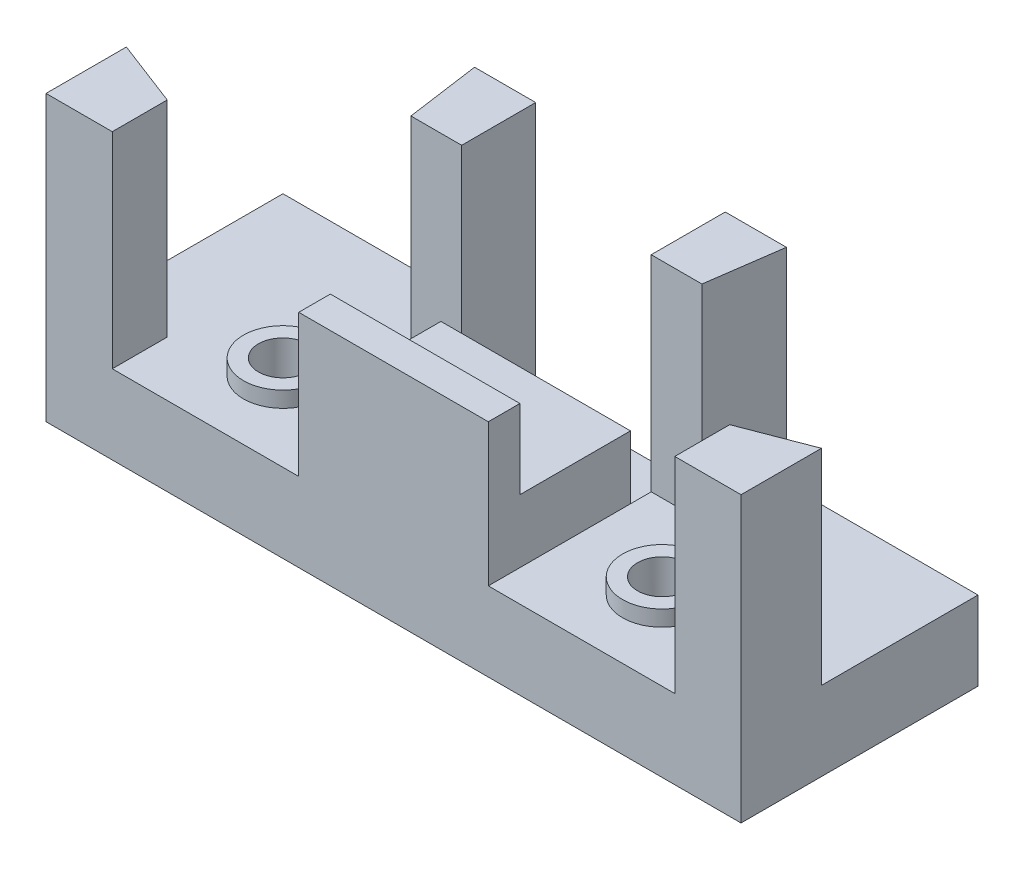
from build123d import *

# Parameters (mm, degrees)
SKETCH1_W           = 44
SKETCH1_H           = 15
BOSS_EXTRUDE1_DEPTH = 5
SKETCH2_W           = 12
SKETCH2_H           = 15
BOSS_EXTRUDE2_DEPTH = 4
SKETCH3_R           = 1.55
CUT_EXTRUDE1_DEPTH  = 3
SKETCH4_R           = 1.55
CUT_EXTRUDE2_DEPTH  = 3
BOSS_EXTRUDE3_START = 1
SKETCH5_R           = 2.5
SKETCH5_R_2         = 1.55
BOSS_EXTRUDE3_DEPTH = 1
SKETCH6_W           = 12
SKETCH6_H           = 2
BOSS_EXTRUDE4_DEPTH = 5
BOSS_EXTRUDE5_DEPTH = 13
SKETCH10_W          = 12
SKETCH10_H          = 6
CUT_EXTRUDE4_DEPTH  = 7


with BuildPart() as part:
    # Sketch1 → Boss-Extrude1 (new body)
    with BuildSketch(Plane(origin=(0, 0, 0), x_dir=(1, 0, 0), z_dir=(0, 1, 0))):
        with Locations((22, -7.5)):
            Rectangle(SKETCH1_W, SKETCH1_H)
    extrude(amount=BOSS_EXTRUDE1_DEPTH)

    # Sketch2 → Boss-Extrude2 (add)
    with BuildSketch(Plane(origin=(0, 5, 0), x_dir=(1, 0, 0), z_dir=(0, 1, 0))):
        with Locations((22, -7.5)):
            Rectangle(SKETCH2_W, SKETCH2_H)
    extrude(amount=BOSS_EXTRUDE2_DEPTH)

    # Sketch3 → Cut-Extrude1 (cut)
    with BuildSketch(Plane(origin=(0, 5, 0), x_dir=(1, 0, 0), z_dir=(0, 1, 0))):
        with Locations((10, -10)):
            Circle(SKETCH3_R)
        with Locations((34, -10)):
            Circle(SKETCH3_R)
    extrude(amount=-CUT_EXTRUDE1_DEPTH, mode=Mode.SUBTRACT)

    # Sketch4 → Cut-Extrude2 (cut)
    with BuildSketch(Plane(origin=(0, 9, 0), x_dir=(1, 0, 0), z_dir=(0, 1, 0))):
        with Locations((22, -10)):
            Circle(SKETCH4_R)
    extrude(amount=-CUT_EXTRUDE2_DEPTH, mode=Mode.SUBTRACT)

    # Sketch5 → Boss-Extrude3 (add)
    # profile 1 of 2: a face of its own
    with BuildSketch(Plane(origin=(0, 5, 0), x_dir=(1, 0, 0), z_dir=(0, 1, 0)).offset(BOSS_EXTRUDE3_START)):
        with Locations((10, -10)):
            Circle(SKETCH5_R)
        with Locations((10, -10)):
            Circle(SKETCH5_R_2, mode=Mode.SUBTRACT)
    # profile 2 of 2: a face of its own
    with BuildSketch(Plane(origin=(0, 5, 0), x_dir=(1, 0, 0), z_dir=(0, 1, 0)).offset(BOSS_EXTRUDE3_START)):
        with Locations((34, -10)):
            Circle(SKETCH5_R)
        with Locations((34, -10)):
            Circle(SKETCH5_R_2, mode=Mode.SUBTRACT)
    extrude(amount=-BOSS_EXTRUDE3_DEPTH)

    # Sketch6 → Boss-Extrude4 (add)
    with BuildSketch(Plane(origin=(0, 9, 0), x_dir=(1, 0, 0), z_dir=(0, 1, 0))):
        with Locations((22, -14)):
            Rectangle(SKETCH6_W, SKETCH6_H)
    extrude(amount=BOSS_EXTRUDE4_DEPTH)

    # Sketch8 → Boss-Extrude5 (add)
    with BuildSketch(Plane(origin=(0, 5, 0), x_dir=(1, 0, 0), z_dir=(0, 1, 0))):
        Polygon((31.212307556, -4.686924541), (31.871011843, 0), (28, 0), (28, -4.686924541), align=None)
        Polygon((39.803996034, -11.521062141), (44, -9.910367127), (44, -15), (39.803996034, -15), align=None)
        Polygon((12.787692444, -4.686924541), (12.128988157, 0), (16, 0), (16, -4.686924541), align=None)
        Polygon((4.196003966, -11.521062141), (0, -9.910367127), (0, -15), (4.196003966, -15), align=None)
    extrude(amount=BOSS_EXTRUDE5_DEPTH)

    # Sketch10 → Cut-Extrude4 (cut)
    with BuildSketch(Plane(origin=(0, 9, 0), x_dir=(1, 0, 0), z_dir=(0, 1, 0))):
        with Locations((22, -3)):
            Rectangle(SKETCH10_W, SKETCH10_H)
    extrude(amount=-CUT_EXTRUDE4_DEPTH, mode=Mode.SUBTRACT)


solid = part.part
